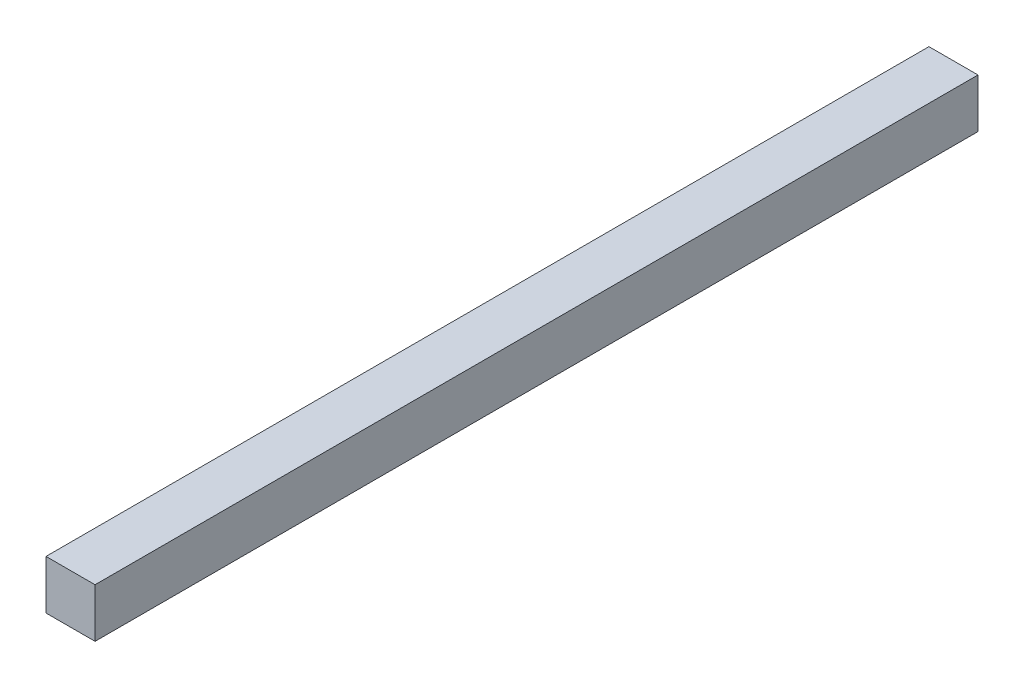
from build123d import *

# Parameters (mm, degrees)
SKETCH2_W           = 25.4
SKETCH2_H           = 25.4
BOSS_EXTRUDE2_DEPTH = 457.2


with BuildPart() as part:
    # Sketch2 → Boss-Extrude2 (new body)
    with BuildSketch(Plane.XY):
        Rectangle(SKETCH2_W, SKETCH2_H)
    extrude(amount=BOSS_EXTRUDE2_DEPTH)


solid = part.part
